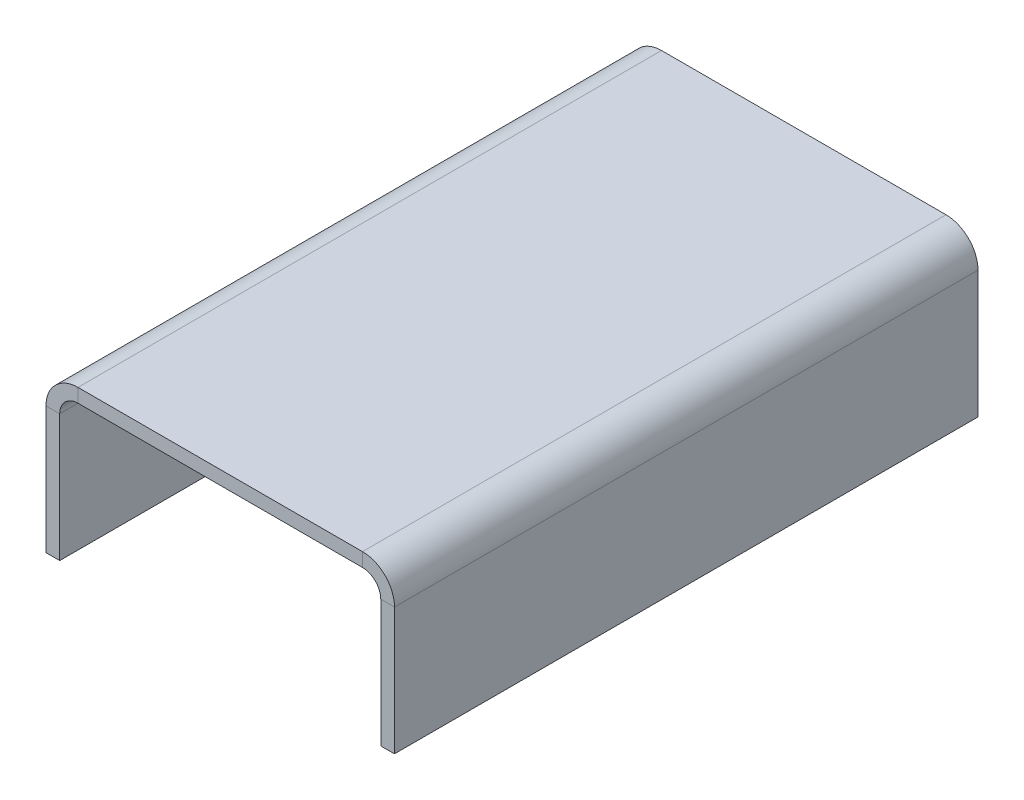
from build123d import *

# Parameters (mm, degrees)
BASE_FLANGE1_DEPTH = 63.8


# Sheet-metal steps are written as plain solids
with BuildPart() as part:
    # Sketch2 → Base-Flange1 (new, symmetric)
    with BuildSketch(Plane.XY):
        with BuildLine():
            Line((-38.1, -17.4), (-38.1, 10.4))
            ThreePointArc((-38.1, 10.4), (-36.049747468, 15.349747468), (-31.1, 17.4))
            Line((-31.1, 17.4), (31.1, 17.4))
            ThreePointArc((31.1, 17.4), (36.049747468, 15.349747468), (38.1, 10.4))
            Line((38.1, 10.4), (38.1, -17.4))
            Line((38.1, -17.4), (35.1, -17.4))
            Line((35.1, -17.4), (35.1, 10.4))
            ThreePointArc((35.1, 10.4), (33.928427125, 13.228427125), (31.1, 14.4))
            Line((31.1, 14.4), (-31.1, 14.4))
            ThreePointArc((-31.1, 14.4), (-33.928427125, 13.228427125), (-35.1, 10.4))
            Line((-35.1, 10.4), (-35.1, -17.4))
            Line((-35.1, -17.4), (-38.1, -17.4))
        make_face()
    extrude(amount=BASE_FLANGE1_DEPTH, both=True)


solid = part.part
